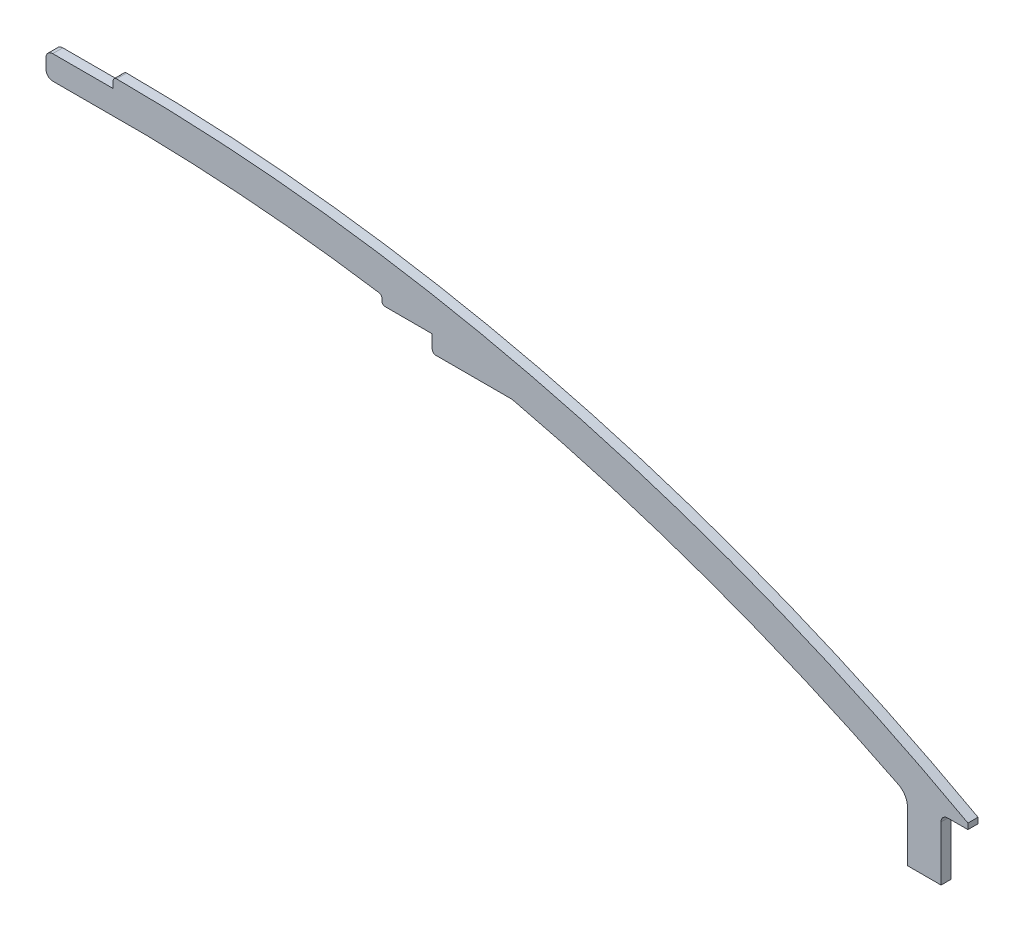
from build123d import *

# Parameters (mm, degrees)
BOSS_EXTRUDE1_DEPTH = 1.5


with BuildPart() as part:
    # Sketch2 → Boss-Extrude1 (new, symmetric)
    with BuildSketch(Plane.XY):
        with BuildLine():
            Line((299.5, -67.353443934), (293.5, -67.353443934))
            ThreePointArc((293.5, -67.353443934), (292.085786438, -67.939230372), (291.5, -69.353443934))
            Line((291.5, -69.353443934), (291.5, -85.649534053))
            Line((291.5, -85.649534053), (281.5, -85.649534053))
            Line((281.5, -85.649534053), (281.5, -70.504592149))
            ThreePointArc((281.5, -70.504592149), (280.757064897, -67.882112699), (278.749040614, -66.038966065))
            ThreePointArc((278.749040614, -66.038966065), (222.498981863, -41.753539728), (163.781589842, -24.257285386))
            Line((163.781589842, -24.257285386), (141, -24.257285386))
            ThreePointArc((141, -24.257285386), (140.292893219, -23.964392167), (140, -23.257285386))
            Line((140, -23.257285386), (140, -19.257285386))
            Line((140, -19.257285386), (126, -19.257285386))
            ThreePointArc((126, -19.257285386), (125.292893219, -18.964392167), (125, -18.257285386))
            Line((125, -18.257285386), (125, -17.551725847))
            ThreePointArc((125, -17.551725847), (124.759050209, -16.900693759), (124.152314439, -16.563393762))
            ThreePointArc((124.152314439, -16.563393762), (89.724531973, -12.428170907), (55.097618142, -10.598112953))
            ThreePointArc((55.097618142, -10.598112953), (55.000467449, -10.596696958), (54.903307584, -10.596224945))
            Line((54.903307584, -10.596224945), (27, -10.596224945))
            ThreePointArc((27, -10.596224945), (25.585786438, -10.010438507), (25, -8.596224945))
            Line((25, -8.596224945), (25, -5.5))
            ThreePointArc((25, -5.5), (25.585786438, -4.085786438), (27, -3.5))
            Line((27, -3.5), (45, -3.5))
            Line((45, -3.5), (45, -1.500945781))
            ThreePointArc((45, -1.500945781), (45.293562303, -0.793170548), (46.001891561, -0.50094757))
            ThreePointArc((46.001891561, -0.50094757), (176.838494864, -17.170276226), (299.5, -65.649534053))
            Line((299.5, -65.649534053), (299.5, -67.353443934))
        make_face()
    extrude(amount=BOSS_EXTRUDE1_DEPTH, both=True)


solid = part.part
